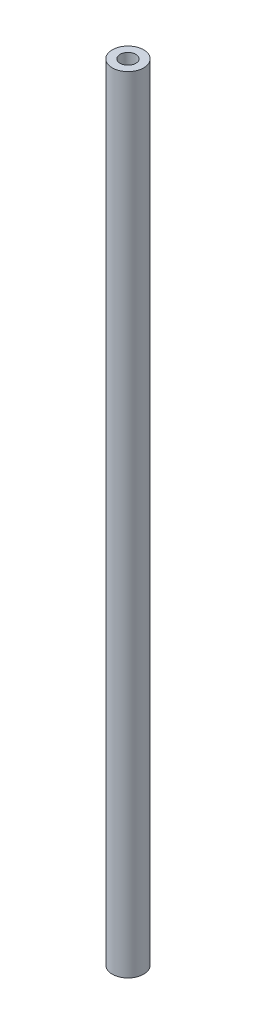
from build123d import *

# Parameters (mm, degrees)
SKETCH_1_R          = 4
EXTRUDE_1_DEPTH     = 200
SKETCH_2_R          = 2
CUT_EXTRUDE_1_DEPTH = 201.079984006


with BuildPart() as part:
    # 草图1 → 凸台-拉伸1 (new body)
    with BuildSketch(Plane(origin=(0, 0, 0), x_dir=(1, 0, 0), z_dir=(0, 1, 0))):
        Circle(SKETCH_1_R)
    extrude(amount=EXTRUDE_1_DEPTH)

    # 草图2 → 切除-拉伸1 (cut, through all)
    with BuildSketch(Plane(origin=(0, 200, 0), x_dir=(1, 0, 0), z_dir=(0, 1, 0))):
        Circle(SKETCH_2_R)
    extrude(amount=-CUT_EXTRUDE_1_DEPTH, mode=Mode.SUBTRACT)


solid = part.part
